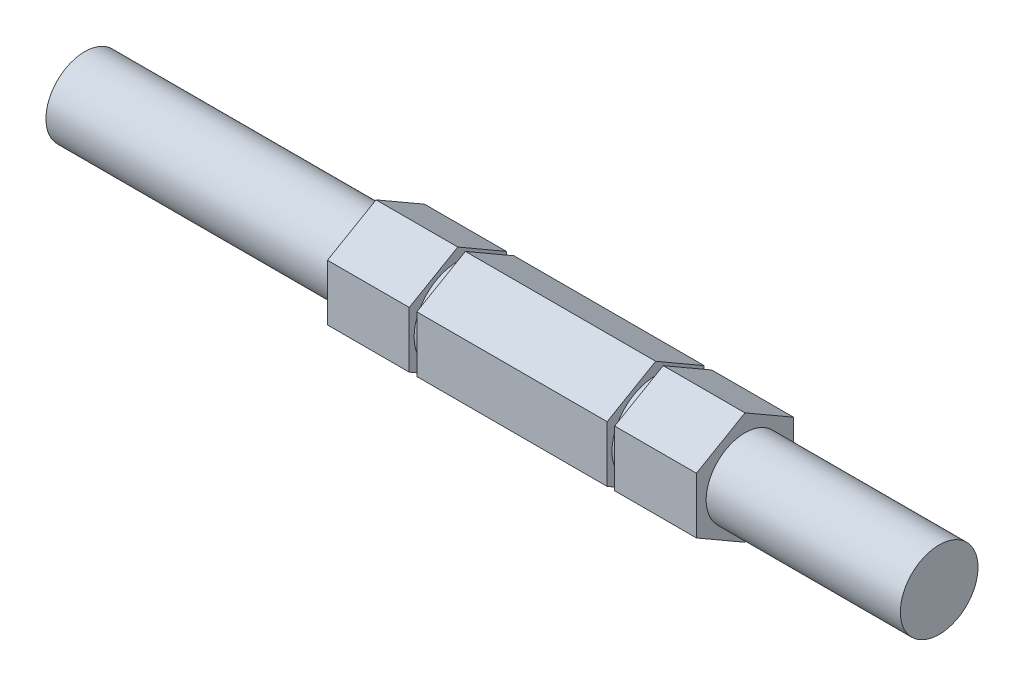
from build123d import *

# Parameters (mm, degrees)
BOSS_EXTRUDE1_DEPTH = 48.26
SKETCH4_R           = 5.08
BOSS_EXTRUDE2_DEPTH = 38.1
BOSS_EXTRUDE3_START = 25.4
SKETCH5_R           = 5.08
BOSS_EXTRUDE3_DEPTH = 25.4
SKETCH3_W           = 0.9906
SKETCH3_H           = 2.218819971


with BuildPart() as part:
    # Sketch1 → Boss-Extrude1 (new body)
    with BuildSketch(Plane(origin=(0, 0, 0), x_dir=(0, 0, -1), z_dir=(1, 0, 0))):
        Polygon((0, -7.332348419), (6.35, -3.666174209), (6.35, 3.666174209), (0, 7.332348419), (-6.35, 3.666174209), (-6.35, -3.666174209), align=None)
    extrude(amount=BOSS_EXTRUDE1_DEPTH)

    # Sketch4 → Boss-Extrude2 (add)
    with BuildSketch(Plane.ZY):
        Circle(SKETCH4_R)
    extrude(amount=BOSS_EXTRUDE2_DEPTH)

    # Sketch5 → Boss-Extrude3 (add)
    with BuildSketch(Plane(origin=(48.26, 0, 0), x_dir=(0, 0, -1), z_dir=(1, 0, 0)).offset(BOSS_EXTRUDE3_START)):
        Circle(SKETCH5_R)
    extrude(amount=-BOSS_EXTRUDE3_DEPTH)

    # Sketch3 → Cut-Revolve2 (revolve, cut)
    with BuildSketch(Plane(origin=(0, 0, 0), x_dir=(1, 0, 0), z_dir=(0, 1, 0))):
        with Locations((37.0713, 6.824409986)):
            Rectangle(SKETCH3_W, SKETCH3_H)
        with Locations((11.1887, 6.824409986)):
            Rectangle(SKETCH3_W, SKETCH3_H)
    revolve(axis=Axis((-57.594560376, 0, 0), (1, 0, 0)), mode=Mode.SUBTRACT)


solid = part.part
